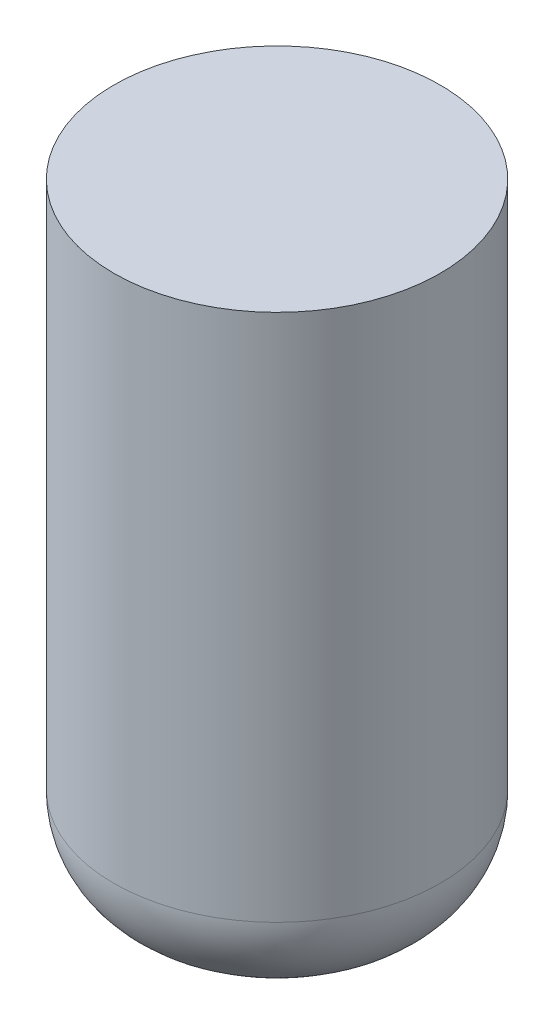
from build123d import *

# Parameters (mm, degrees)
SKETCH1_R           = 2.1
BOSS_EXTRUDE1_DEPTH = 8
FILLET2_R           = 1.2


with BuildPart() as part:
    # Sketch1 → Boss-Extrude1 (new body)
    with BuildSketch(Plane(origin=(0, 0, 0), x_dir=(1, 0, 0), z_dir=(0, 1, 0))):
        Circle(SKETCH1_R)
    extrude(amount=BOSS_EXTRUDE1_DEPTH)

    # Fillet2
    fillet2_edges = [part.edges().sort_by_distance(p)[0] for p in [
        (-2.1, 0, 0),
    ]]
    fillet(fillet2_edges, radius=FILLET2_R)


solid = part.part
